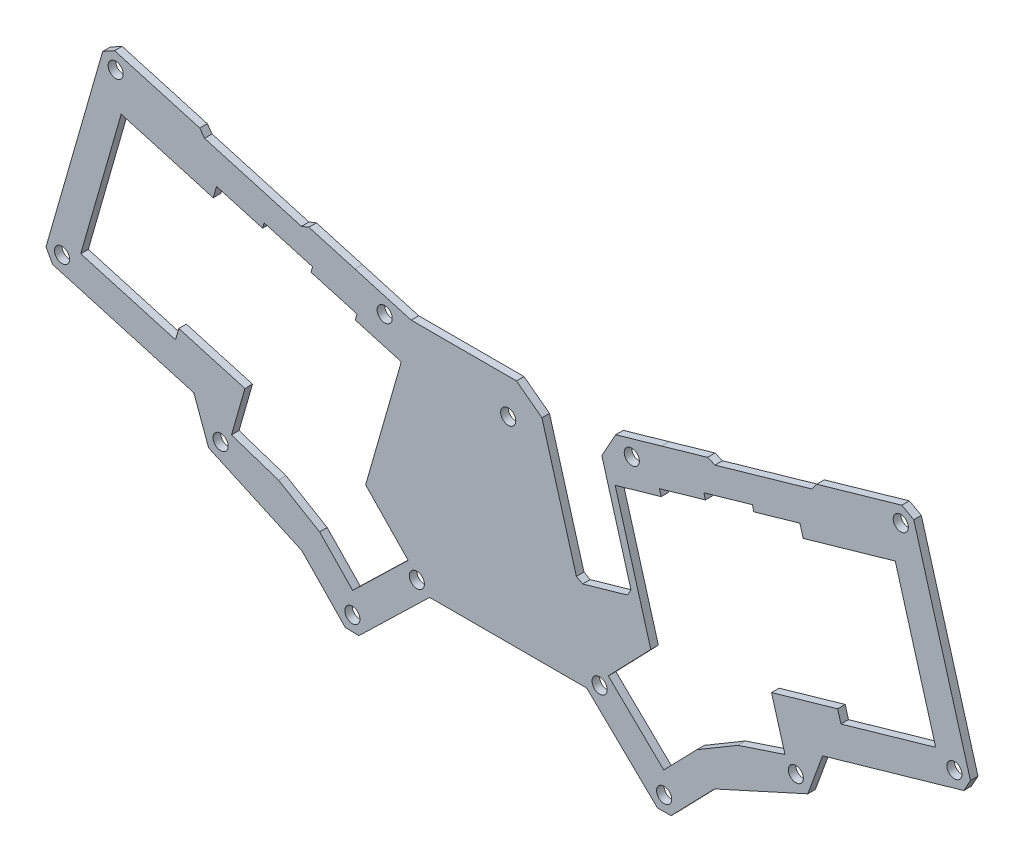
from build123d import *

# Parameters (mm, degrees)
ESQUISSE1_R        = 3
BOSS_EXTRU_1_DEPTH = 3


with BuildPart() as part:
    # Esquisse1 → Boss.-Extru.1 (new body)
    with BuildSketch(Plane.XY):
        Polygon((-130.649820486, -22.415487094), (-119.070790786, -62.796362516), (-120.442039466, -65.27016062), (-138.268849115, -70.381916029), (-140.742647218, -69.010667349), (-154.419403971, -21.314148304), (-164.521687886, -13.701531345), (-206.306232172, -13.701531345), (-221.961778647, -9.212375631), (-228.687205956, -7.283890383), (-246.894010665, -2.064269008), (-249.872259625, -3.248768002), (-288.323340616, 7.774587685), (-290.221637422, 10.357120157), (-324.023652204, 20.047657387), (-328.759186056, 17.422535954), (-351.248940808, -61.008559605), (-348.624077987, -65.743937486), (-292.570685007, -81.816989279), (-286.703799003, -97.823971184), (-249.693611115, -114.655437515), (-232.462472657, -132.451258614), (-227.051679806, -132.536382762), (-198.975350278, -105.350948678), (-136.615169465, -105.350948678), (-108.538839937, -132.536382762), (-103.128047086, -132.451258614), (-85.896908628, -114.655437515), (-48.88672074, -97.823971184), (-43.019834736, -81.816989279), (13.033558244, -65.743937486), (15.658421065, -61.008559605), (-6.831333687, 17.422535954), (-11.566867539, 20.047657387), (-45.368882322, 10.357120157), (-47.267179127, 7.774587685), (-85.718260118, -3.248768002), (-88.696509078, -2.064269008), (-106.903313787, -7.283890383), (-113.628741096, -9.212375631), (-125.164825765, -12.52029468), align=None)
        with Locations((-229.666591606, -126.713325795)):
            Circle(ESQUISSE1_R, mode=Mode.SUBTRACT)
        with Locations((-204.059552706, -101.880200807)):
            Circle(ESQUISSE1_R, mode=Mode.SUBTRACT)
        with Locations((-281.934339477, -93.401689518)):
            Circle(ESQUISSE1_R, mode=Mode.SUBTRACT)
        with Locations((-344.882804027, -60.574933915)):
            Circle(ESQUISSE1_R, mode=Mode.SUBTRACT)
        Polygon((-210.232188047, -30.001147656), (-224.390430785, -79.377961929), (-208.212806214, -96.161100182), (-207.491865187, -96.85509979), (-208.236606037, -97.572971364), (-229.533063287, -118.225792128), (-242.655085998, -104.673746846), (-258.969310369, -95.012679745), (-277.629290011, -88.825419148), (-272.289144354, -70.202118055), (-298.538981418, -62.6750984), (-299.849714513, -67.246167925), (-337.461409717, -56.461187875), (-321.404434006, -0.463858857), (-284.873898651, -10.938821309), (-283.564528345, -6.372504389), (-265.299260667, -11.609985616), (-264.679553884, -9.448811229), (-245.452786066, -14.960840928), (-246.072799476, -17.123084647), (-227.807531798, -22.360565873), (-228.496674065, -24.763890567), align=None, mode=Mode.SUBTRACT)
        with Locations((-105.923928137, -126.713325795)):
            Circle(ESQUISSE1_R, mode=Mode.SUBTRACT)
        with Locations((-131.530967037, -101.880200807)):
            Circle(ESQUISSE1_R, mode=Mode.SUBTRACT)
        with Locations((-53.656180266, -93.401689518)):
            Circle(ESQUISSE1_R, mode=Mode.SUBTRACT)
        Polygon((-106.057456456, -118.225792128), (-128.0696158, -96.878899722), (-127.377713529, -96.161100182), (-111.200088958, -79.377961929), (-125.358331696, -30.001147656), (-107.093845678, -24.763890567), (-107.782987945, -22.360565873), (-89.517720268, -17.123084647), (-90.137733677, -14.960840928), (-70.910965859, -9.448811229), (-70.291259076, -11.609985616), (-52.025991399, -6.372504389), (-50.716621092, -10.938821309), (-14.186085737, -0.463858857), (1.870889973, -56.461187875), (-35.740805231, -67.246167925), (-37.051538325, -62.6750984), (-63.301375389, -70.202118055), (-57.961229733, -88.825419148), (-76.621209374, -95.012679745), (-92.935433745, -104.673746846), align=None, mode=Mode.SUBTRACT)
        with Locations((9.292284284, -60.574933915)):
            Circle(ESQUISSE1_R, mode=Mode.SUBTRACT)
        with Locations((-323.590068827, 13.68165837)):
            Circle(ESQUISSE1_R, mode=Mode.SUBTRACT)
        with Locations((-216.832585966, -16.924131519)):
            Circle(ESQUISSE1_R, mode=Mode.SUBTRACT)
        with Locations((-167.795259872, -27.605548894)):
            Circle(ESQUISSE1_R, mode=Mode.SUBTRACT)
        with Locations((-118.757933777, -16.924131519)):
            Circle(ESQUISSE1_R, mode=Mode.SUBTRACT)
        with Locations((-12.000450916, 13.68165837)):
            Circle(ESQUISSE1_R, mode=Mode.SUBTRACT)
    extrude(amount=BOSS_EXTRU_1_DEPTH)


solid = part.part
